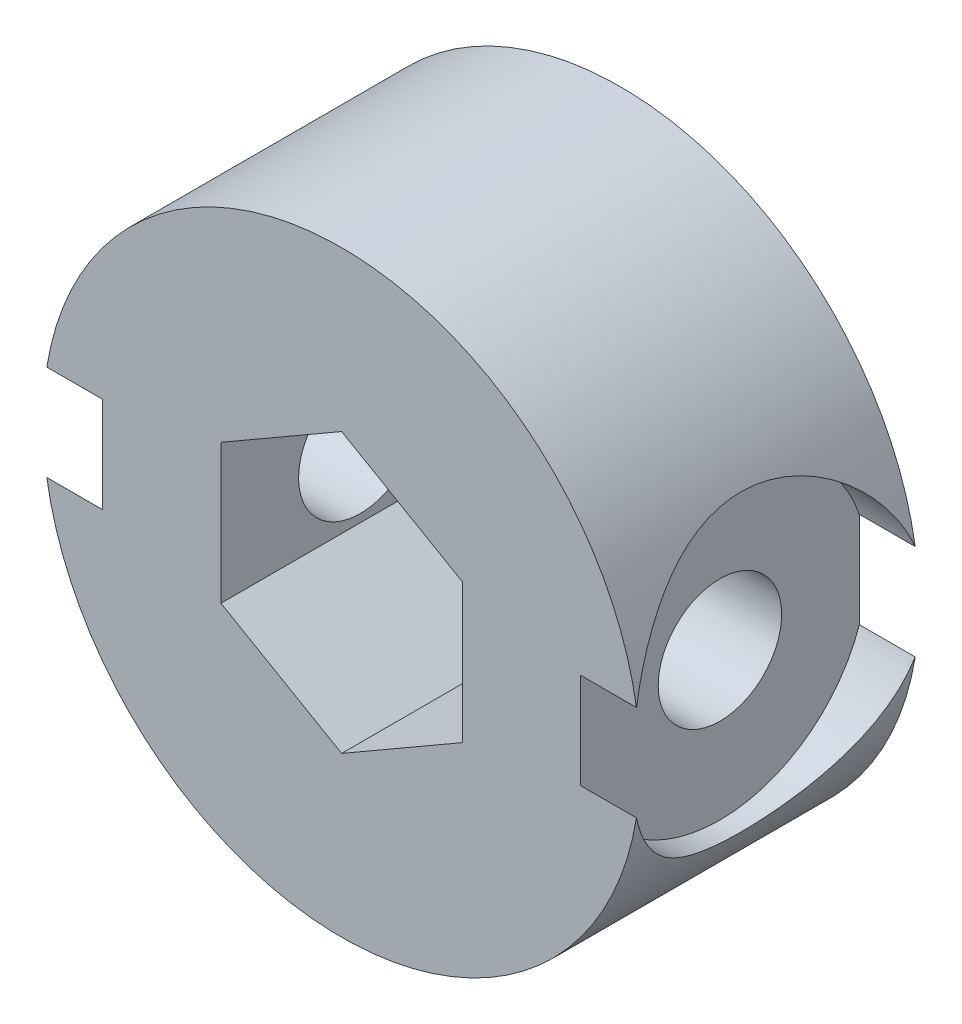
from build123d import *

# Parameters (mm, degrees)
SKETCH1_R               = 7.5
BOSS_EXTRUDE2_DEPTH     = 7
CUT_EXTRUDE1_DEPTH      = 7.5
CUT_EXTRUDE1_DEPTH_BACK = 7.5
SKETCH2_R               = 1.55
SKETCH4_R               = 3.7
CUT_EXTRUDE2_DEPTH      = 4
CUT_EXTRUDE3_START      = -4
SKETCH5_R               = 3.7
CUT_EXTRUDE3_DEPTH      = 4


with BuildPart() as part:
    # Sketch1 → Boss-Extrude2 (new body)
    with BuildSketch(Plane.XY):
        Circle(SKETCH1_R)
        Polygon((-3.031088913, 1.75), (0, 3.5), (3.031088913, 1.75), (3.031088913, -1.75), (0, -3.5), (-3.031088913, -1.75), align=None, mode=Mode.SUBTRACT)
    extrude(amount=BOSS_EXTRUDE2_DEPTH)

    # Sketch2 → Cut-Extrude1 (cut, two sides: drawn at the far end of the back side and taken through both)
    with BuildSketch(Plane.ZY.offset(-CUT_EXTRUDE1_DEPTH_BACK)):
        with Locations((3.5, 0)):
            Circle(SKETCH2_R)
    extrude(amount=CUT_EXTRUDE1_DEPTH + CUT_EXTRUDE1_DEPTH_BACK, mode=Mode.SUBTRACT)

    # Sketch4 → Cut-Extrude2 (cut)
    with BuildSketch(Plane.ZY.offset(6)):
        with Locations((3.5, 0)):
            Circle(SKETCH4_R)
    extrude(amount=CUT_EXTRUDE2_DEPTH, mode=Mode.SUBTRACT)

    # Sketch5 → Cut-Extrude3 (cut)
    with BuildSketch(Plane.ZY.offset(-6).offset(CUT_EXTRUDE3_START)):
        with Locations((3.5, 0)):
            Circle(SKETCH5_R)
    extrude(amount=CUT_EXTRUDE3_DEPTH, mode=Mode.SUBTRACT)


solid = part.part
